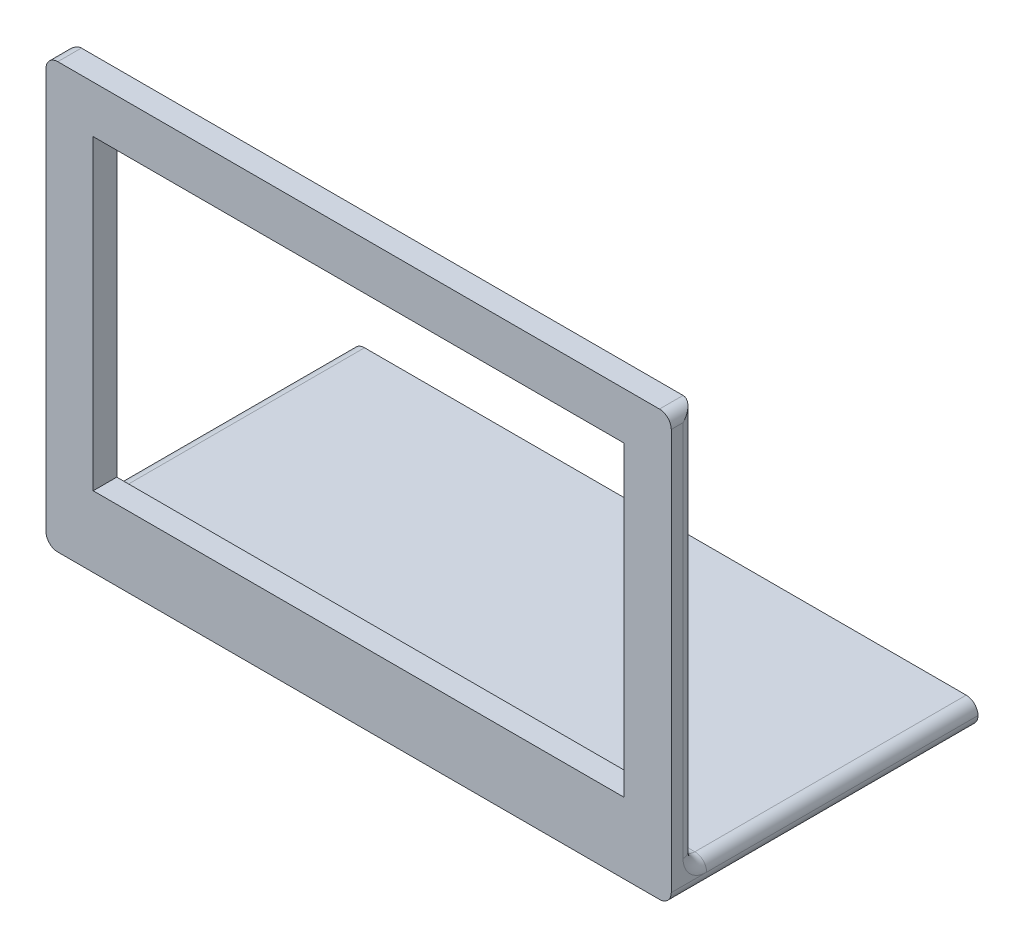
from build123d import *

# Parameters (mm, degrees)
SKETCH1_W           = 53
SKETCH1_H           = 2
SKETCH1_H_2         = 34
SKETCH1_W_2         = 45
SKETCH1_H_3         = 26
BOSS_EXTRUDE1_DEPTH = 2
SKETCH1_5_W         = 53
SKETCH1_5_H         = 2
BOSS_EXTRUDE4_DEPTH = 24
FILLET2_R           = 1


with BuildPart() as part:
    # Sketch1 → Boss-Extrude1 (new body)
    # profile 1 of 2: a face of its own
    with BuildSketch(Plane.XY):
        with Locations((-2.283686935, 15.83542926)):
            Rectangle(SKETCH1_W, SKETCH1_H)
    # profile 2 of 2: a face of its own
    with BuildSketch(Plane.XY):
        with Locations((-2.283686935, 33.83542926)):
            Rectangle(SKETCH1_W, SKETCH1_H_2)
        with Locations((-2.283686935, 33.83542926)):
            Rectangle(SKETCH1_W_2, SKETCH1_H_3, mode=Mode.SUBTRACT)
    extrude(amount=BOSS_EXTRUDE1_DEPTH)

    # Sketch1<5> → Boss-Extrude4 (add)
    with BuildSketch(Plane.XY):
        with Locations((-2.283686935, 15.83542926)):
            Rectangle(SKETCH1_5_W, SKETCH1_5_H)
    extrude(amount=-BOSS_EXTRUDE4_DEPTH)

    # Fillet2
    fillet2_edges = [part.edges().sort_by_distance(p)[0] for p in [
        (-28.783686935, 33.83542926, 0),
        (24.216313065, 33.83542926, 0),
        (-2.283686935, 16.83542926, 0),
        (-28.783686935, 16.83542926, -12),
        (24.216313065, 16.83542926, -12),
        (24.216313065, 50.83542926, 1),
        (24.216313065, 14.83542926, -11),
        (-28.783686935, 50.83542926, 1),
        (-28.783686935, 14.83542926, -11),
    ]]
    fillet(fillet2_edges, radius=FILLET2_R - 0.0001)  # a hair under: the kernel refuses the full size


solid = part.part
